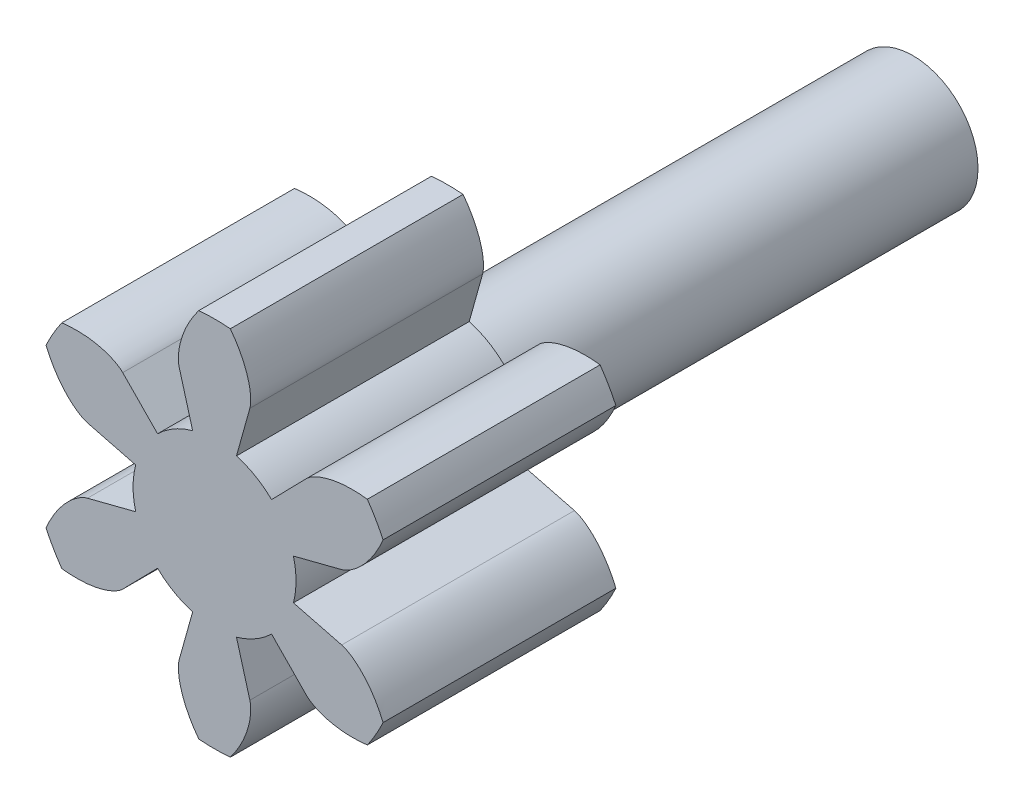
from build123d import *

# Parameters (mm, degrees)
SKETCH_1_R               = 4
SKETCH_1_R_2             = 1.4
EXTRUDE_1_DEPTH          = 5
CUT_EXTRUDE_1_DEPTH      = 8.549834435
PATTERN_CIRCULAR_1_COUNT = 6
PATTERN_CIRCULAR_1_ANGLE = 300
EXTRUDE_START            = -15
SKETCH_2_R               = 1.4
EXTRUDE_2_DEPTH          = 15


with BuildPart() as part:
    # 草图1 → 凸台-拉伸1 (new body)
    with BuildSketch(Plane.XY):
        Circle(SKETCH_1_R)
        Circle(SKETCH_1_R_2, mode=Mode.SUBTRACT)
    extrude(amount=EXTRUDE_1_DEPTH)

    # 草图1<3> → 切除-拉伸1 (cut, through all)
    with BuildSketch(Plane.XY):
        with BuildLine():
            Line((2.730540893, 0.700961074), (1.695038873, 0.435135863))
            ThreePointArc((1.695038873, 0.435135863), (1.736205349, 0.219296571), (1.75, 0))
            ThreePointArc((1.75, 0), (1.736205349, -0.219296571), (1.695038873, -0.435135863))
            Line((1.695038873, -0.435135863), (2.730540893, -0.700961074))
            add(Edge.make_bspline(
                [(2.730540893, -0.700961074), (2.751355068, -0.706304311), (2.808329953, -0.725541446), (2.910522768, -0.778982289), (3.06267796, -0.887491262), (3.235956594, -1.057334282), (3.408810129, -1.2831446), (3.52264255, -1.482702951), (3.589508983, -1.625182096), (3.620975996, -1.699568426)],
                knots=[0, 0, 0, 0, 0, 0.005604068, 0.015718248, 0.029959916, 0.048733667, 0.068727063, 0.089838728, 0.089838728, 0.089838728, 0.089838728, 0.089838728], degree=4))
            ThreePointArc((3.620975996, -1.699568426), (3.90409426, -0.870659525), (4, 0))
            ThreePointArc((4, 0), (3.90409426, 0.870659525), (3.620975996, 1.699568426))
            add(Edge.make_bspline(
                [(2.730540893, 0.700961074), (2.751355068, 0.706304311), (2.808329953, 0.725541446), (2.910522768, 0.778982289), (3.06267796, 0.887491262), (3.235956594, 1.057334282), (3.408810129, 1.2831446), (3.52264255, 1.482702951), (3.589508983, 1.625182096), (3.620975996, 1.699568426)],
                knots=[0, 0, 0, 0, 0, 0.005604068, 0.015718248, 0.029959916, 0.048733667, 0.068727063, 0.089838728, 0.089838728, 0.089838728, 0.089838728, 0.089838728], degree=4))
        make_face()
    cut_extrude_1 = extrude(amount=CUT_EXTRUDE_1_DEPTH, mode=Mode.SUBTRACT)

    # 阵列(圆周)1: 切除-拉伸1 ×6 about axis
    pattern_circular_1_axis = Axis((0, 0, 5), (0, 0, 1))
    for i in range(1, PATTERN_CIRCULAR_1_COUNT):
        add(cut_extrude_1.rotate(pattern_circular_1_axis, i * PATTERN_CIRCULAR_1_ANGLE / (PATTERN_CIRCULAR_1_COUNT - 1)), mode=Mode.SUBTRACT)

    # 草图2 → 凸台-拉伸2 (add)
    with BuildSketch(Plane.XY.offset(5).offset(EXTRUDE_START)):
        Circle(SKETCH_2_R)
    extrude(amount=EXTRUDE_2_DEPTH)


solid = part.part
